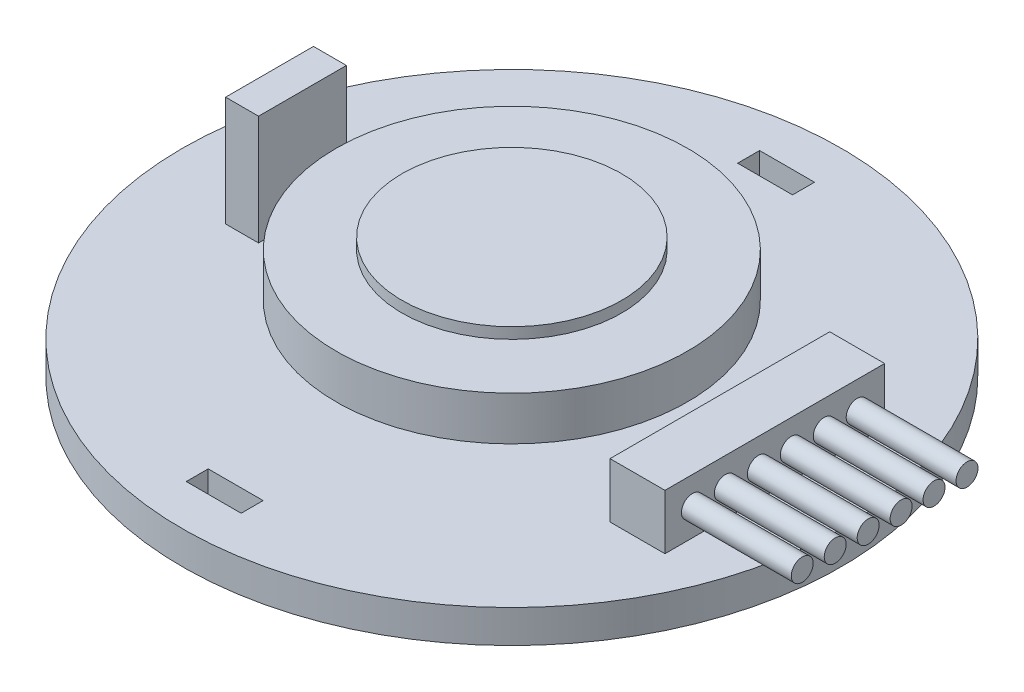
from build123d import *

# Parameters (mm, degrees)
CUT_EXTRUDE1_REACH  = 23.935
SKETCH2_W           = 2.5
SKETCH2_H           = 1
SKETCH3_W           = 1.5
SKETCH3_H           = 4
BOSS_EXTRUDE1_DEPTH = 5
SKETCH3_3_W         = 2.5
SKETCH3_3_H         = 10
BOSS_EXTRUDE2_DEPTH = 2.5
SKETCH5_R           = 0.5
BOSS_EXTRUDE4_DEPTH = 5


with BuildPart() as part:
    # Sketch1 → Revolve1 (revolve)
    with BuildSketch(Plane.XY):
        Polygon((0.030129717, -4.421866179), (1.230129717, -4.421866179), (1.230129717, -0.421866179), (15.030129717, -0.421866179), (15.030129717, 1.078133821), (1.230129717, 1.078133821), (1.030129717, 2.078133821), (1.030129717, 2.578133821), (8.030129717, 2.578133821), (8.030129717, 4.578133821), (5.030129717, 4.578133821), (5.030129717, 5.078133821), (0.030129717, 5.078133821), align=None)
    revolve(axis=Axis((0.030129717, 5.078133821, 0), (0, -1, 0)))

    # Sketch2 → Cut-Extrude1 (cut, up to next)
    with BuildSketch(Plane.XZ.offset(0.421866179), mode=Mode.PRIVATE) as cut_extrude1_sk1:
        with Locations((-0.492014974, -12.55)):
            Rectangle(SKETCH2_W, SKETCH2_H)
    cut_extrude1_tool1 = extrude(cut_extrude1_sk1.sketch, amount=-CUT_EXTRUDE1_REACH, mode=Mode.PRIVATE) & part.part
    # Sketch2 → Cut-Extrude1 (cut, up to next)
    with BuildSketch(Plane.XZ.offset(0.421866179), mode=Mode.PRIVATE) as cut_extrude1_sk2:
        with Locations((-0.492014974, 12.55)):
            Rectangle(SKETCH2_W, SKETCH2_H)
    cut_extrude1_tool2 = extrude(cut_extrude1_sk2.sketch, amount=-CUT_EXTRUDE1_REACH, mode=Mode.PRIVATE) & part.part
    add(cut_extrude1_tool1.solids().sort_by_distance((-0.492015, -0.421866, -12.55))[0], mode=Mode.SUBTRACT)
    add(cut_extrude1_tool2.solids().sort_by_distance((-0.492015, -0.421866, 12.55))[0], mode=Mode.SUBTRACT)

    # Sketch3 → Boss-Extrude1 (add)
    with BuildSketch(Plane(origin=(0, 1.078133821, 0), x_dir=(1, 0, 0), z_dir=(0, 1, 0))):
        with Locations((-10.25, 0)):
            Rectangle(SKETCH3_W, SKETCH3_H)
    extrude(amount=BOSS_EXTRUDE1_DEPTH)

    # Sketch3<3> → Boss-Extrude2 (add)
    with BuildSketch(Plane(origin=(0, 1.078133821, 0), x_dir=(1, 0, 0), z_dir=(0, 1, 0))):
        with Locations((10.75, 0)):
            Rectangle(SKETCH3_3_W, SKETCH3_3_H)
    extrude(amount=BOSS_EXTRUDE2_DEPTH)

    # Sketch5 → Boss-Extrude4 (add)
    with BuildSketch(Plane(origin=(12, 0, 0), x_dir=(0, 0, -1), z_dir=(1, 0, 0))):
        with Locations((-3.75, 2.328133821)):
            Circle(SKETCH5_R)
        with Locations((-2.25, 2.328133821)):
            Circle(SKETCH5_R)
        with Locations((-0.75, 2.328133821)):
            Circle(SKETCH5_R)
        with Locations((0.75, 2.328133821)):
            Circle(SKETCH5_R)
        with Locations((2.25, 2.328133821)):
            Circle(SKETCH5_R)
        with Locations((3.75, 2.328133821)):
            Circle(SKETCH5_R)
    extrude(amount=BOSS_EXTRUDE4_DEPTH)


solid = part.part
